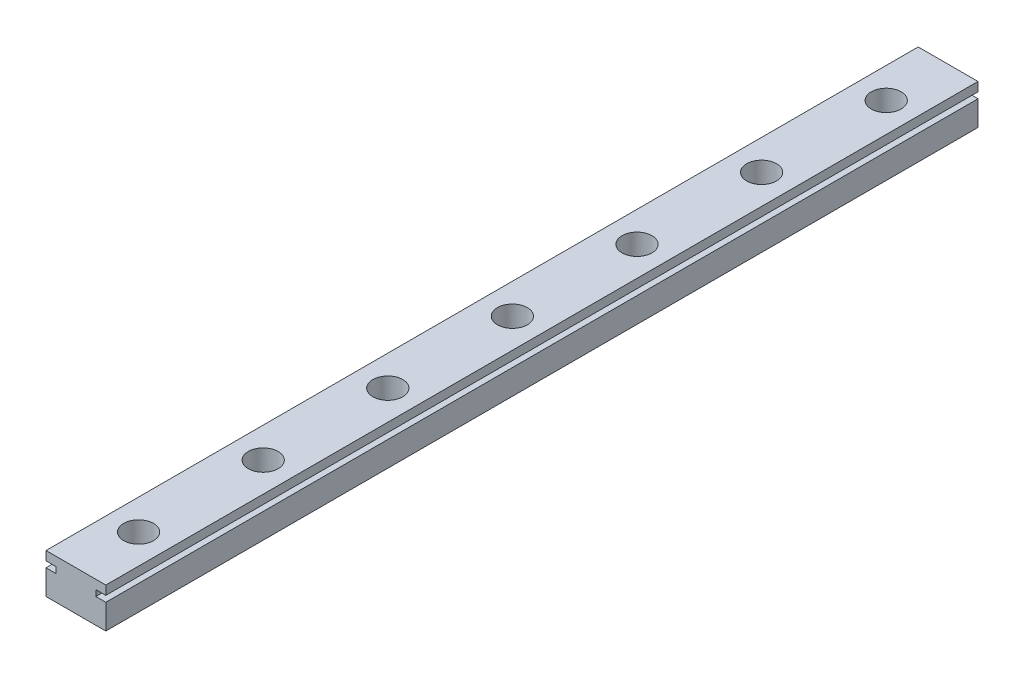
from build123d import *

# Parameters (mm, degrees)
BOSS_EXTRU_1_DEPTH      = 175
ESQUISSE2_R             = 3
ENL_V_MAT_EXTRU_1_DEPTH = 4.5
ENL_V_MAT_EXTRU_2_REACH = 177.327
ESQUISSE3_R             = 1.75


with BuildPart() as part:
    # Esquisse1 → Boss.-Extru.1 (new body)
    with BuildSketch(Plane.XY):
        Polygon((-2.287966089, -3.148854962), (9.712033911, -3.148854962), (9.712033911, 1.851145038), (7.712033911, 1.851145038), (7.712033911, 3.051145038), (9.712033911, 3.051145038), (9.712033911, 4.851145038), (-2.287966089, 4.851145038), (-2.287966089, 3.051145038), (-0.287966089, 3.051145038), (-0.287966089, 1.851145038), (-2.287966089, 1.851145038), align=None)
    extrude(amount=BOSS_EXTRU_1_DEPTH)

    # Esquisse2 → Enlèv. mat.-Extru.1 (cut)
    with BuildSketch(Plane(origin=(0, 4.851145038, 0), x_dir=(1, 0, 0), z_dir=(0, 1, 0))):
        with Locations((3.792841972, -162.5)):
            Circle(ESQUISSE2_R)
        with Locations((3.792841972, -137.5)):
            Circle(ESQUISSE2_R)
        with Locations((3.792841972, -112.5)):
            Circle(ESQUISSE2_R)
        with Locations((3.792841972, -87.5)):
            Circle(ESQUISSE2_R)
        with Locations((3.792841972, -62.5)):
            Circle(ESQUISSE2_R)
        with Locations((3.792841972, -37.5)):
            Circle(ESQUISSE2_R)
        with Locations((3.792841972, -12.5)):
            Circle(ESQUISSE2_R)
    extrude(amount=-ENL_V_MAT_EXTRU_1_DEPTH, mode=Mode.SUBTRACT)

    # Esquisse3 → Enlèv. mat.-Extru.2 (cut, up to next)
    with BuildSketch(Plane(origin=(0, 0.351145038, 0), x_dir=(1, 0, 0), z_dir=(0, 1, 0)), mode=Mode.PRIVATE) as enl_v_mat_extru_2_sk1:
        with Locations((3.792841972, -162.5)):
            Circle(ESQUISSE3_R)
    enl_v_mat_extru_2_tool1 = extrude(enl_v_mat_extru_2_sk1.sketch, amount=-ENL_V_MAT_EXTRU_2_REACH, mode=Mode.PRIVATE) & part.part
    # Esquisse3 → Enlèv. mat.-Extru.2 (cut, up to next)
    with BuildSketch(Plane(origin=(0, 0.351145038, 0), x_dir=(1, 0, 0), z_dir=(0, 1, 0)), mode=Mode.PRIVATE) as enl_v_mat_extru_2_sk2:
        with Locations((3.792841972, -137.5)):
            Circle(ESQUISSE3_R)
    enl_v_mat_extru_2_tool2 = extrude(enl_v_mat_extru_2_sk2.sketch, amount=-ENL_V_MAT_EXTRU_2_REACH, mode=Mode.PRIVATE) & part.part
    # Esquisse3 → Enlèv. mat.-Extru.2 (cut, up to next)
    with BuildSketch(Plane(origin=(0, 0.351145038, 0), x_dir=(1, 0, 0), z_dir=(0, 1, 0)), mode=Mode.PRIVATE) as enl_v_mat_extru_2_sk3:
        with Locations((3.792841972, -112.5)):
            Circle(ESQUISSE3_R)
    enl_v_mat_extru_2_tool3 = extrude(enl_v_mat_extru_2_sk3.sketch, amount=-ENL_V_MAT_EXTRU_2_REACH, mode=Mode.PRIVATE) & part.part
    # Esquisse3 → Enlèv. mat.-Extru.2 (cut, up to next)
    with BuildSketch(Plane(origin=(0, 0.351145038, 0), x_dir=(1, 0, 0), z_dir=(0, 1, 0)), mode=Mode.PRIVATE) as enl_v_mat_extru_2_sk4:
        with Locations((3.792841972, -87.5)):
            Circle(ESQUISSE3_R)
    enl_v_mat_extru_2_tool4 = extrude(enl_v_mat_extru_2_sk4.sketch, amount=-ENL_V_MAT_EXTRU_2_REACH, mode=Mode.PRIVATE) & part.part
    # Esquisse3 → Enlèv. mat.-Extru.2 (cut, up to next)
    with BuildSketch(Plane(origin=(0, 0.351145038, 0), x_dir=(1, 0, 0), z_dir=(0, 1, 0)), mode=Mode.PRIVATE) as enl_v_mat_extru_2_sk5:
        with Locations((3.792841972, -62.5)):
            Circle(ESQUISSE3_R)
    enl_v_mat_extru_2_tool5 = extrude(enl_v_mat_extru_2_sk5.sketch, amount=-ENL_V_MAT_EXTRU_2_REACH, mode=Mode.PRIVATE) & part.part
    # Esquisse3 → Enlèv. mat.-Extru.2 (cut, up to next)
    with BuildSketch(Plane(origin=(0, 0.351145038, 0), x_dir=(1, 0, 0), z_dir=(0, 1, 0)), mode=Mode.PRIVATE) as enl_v_mat_extru_2_sk6:
        with Locations((3.792841972, -37.5)):
            Circle(ESQUISSE3_R)
    enl_v_mat_extru_2_tool6 = extrude(enl_v_mat_extru_2_sk6.sketch, amount=-ENL_V_MAT_EXTRU_2_REACH, mode=Mode.PRIVATE) & part.part
    # Esquisse3 → Enlèv. mat.-Extru.2 (cut, up to next)
    with BuildSketch(Plane(origin=(0, 0.351145038, 0), x_dir=(1, 0, 0), z_dir=(0, 1, 0)), mode=Mode.PRIVATE) as enl_v_mat_extru_2_sk7:
        with Locations((3.792841972, -12.5)):
            Circle(ESQUISSE3_R)
    enl_v_mat_extru_2_tool7 = extrude(enl_v_mat_extru_2_sk7.sketch, amount=-ENL_V_MAT_EXTRU_2_REACH, mode=Mode.PRIVATE) & part.part
    add(enl_v_mat_extru_2_tool1.solids().sort_by_distance((3.792842, 0.351145, 162.5))[0], mode=Mode.SUBTRACT)
    add(enl_v_mat_extru_2_tool2.solids().sort_by_distance((3.792842, 0.351145, 137.5))[0], mode=Mode.SUBTRACT)
    add(enl_v_mat_extru_2_tool3.solids().sort_by_distance((3.792842, 0.351145, 112.5))[0], mode=Mode.SUBTRACT)
    add(enl_v_mat_extru_2_tool4.solids().sort_by_distance((3.792842, 0.351145, 87.5))[0], mode=Mode.SUBTRACT)
    add(enl_v_mat_extru_2_tool5.solids().sort_by_distance((3.792842, 0.351145, 62.5))[0], mode=Mode.SUBTRACT)
    add(enl_v_mat_extru_2_tool6.solids().sort_by_distance((3.792842, 0.351145, 37.5))[0], mode=Mode.SUBTRACT)
    add(enl_v_mat_extru_2_tool7.solids().sort_by_distance((3.792842, 0.351145, 12.5))[0], mode=Mode.SUBTRACT)


solid = part.part
